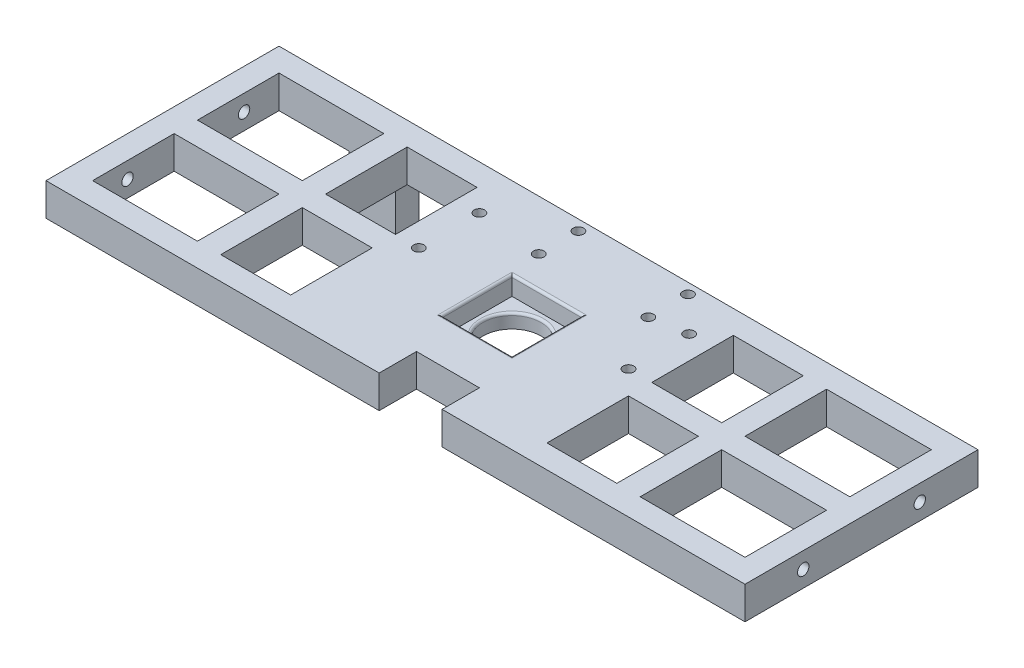
from build123d import *

# Parameters (mm, degrees)
SKETCH_1_W           = 300
SKETCH_1_H           = 100
EXTRUDE_1_DEPTH      = 16
SKETCH_2_W           = 30
SKETCH_2_H           = 30
CUT_EXTRUDE_1_DEPTH  = 8
SKETCH_3_R           = 12.5
CUT_EXTRUDE_2_DEPTH  = 14
CUT_EXTRUDE_3_REACH  = 318.632
SKETCH_4_W           = 50
SKETCH_4_H           = 35
SKETCH_7_W           = 35
SKETCH_7_H           = 16
EXTRUDE_2_DEPTH      = 20
SKETCH_8_W           = 35
SKETCH_8_H           = 16
EXTRUDE_3_DEPTH      = 20
SKETCH_9_W           = 20
SKETCH_9_H           = 10
EXTRUDE_4_DEPTH      = 25
FILLET_1_R           = 1
FILLET_2_R           = 1
SKETCH_13_W          = 35
SKETCH_13_H          = 16
EXTRUDE_6_DEPTH      = 4
SKETCH_14_W          = 35
SKETCH_14_H          = 16
EXTRUDE_7_DEPTH      = 4
SKETCH_17_W          = 35
SKETCH_17_H          = 16
EXTRUDE_8_DEPTH      = 1
SKETCH_18_W          = 35
SKETCH_18_H          = 16
EXTRUDE_9_DEPTH      = 1
CUT_EXTRUDE_15_DEPTH = 2
SKETCH_28_R          = 2.25
CUT_EXTRUDE_18_DEPTH = 5
SKETCH_30_R          = 1.5
CUT_EXTRUDE_20_DEPTH = 4
SKETCH_33_R          = 2.45
CUT_EXTRUDE_22_DEPTH = 13.2
CUT_EXTRUDE_START    = -13.2
SKETCH_34_R          = 2.45
CUT_EXTRUDE_23_DEPTH = 13.2
SKETCH_35_W          = 27
SKETCH_35_H          = 16
CUT_EXTRUDE_24_DEPTH = 20


with BuildPart() as part:
    # 草图1 → 凸台-拉伸1 (new body)
    with BuildSketch(Plane(origin=(0, 0, 0), x_dir=(1, 0, 0), z_dir=(0, 1, 0))):
        with Locations((-150, 50)):
            Rectangle(SKETCH_1_W, SKETCH_1_H)
    extrude(amount=EXTRUDE_1_DEPTH)

    # 草图2 → 切除-拉伸1 (cut)
    with BuildSketch(Plane(origin=(0, 16, 0), x_dir=(1, 0, 0), z_dir=(0, 1, 0))):
        with Locations((-150, 50)):
            Rectangle(SKETCH_2_W, SKETCH_2_H)
    extrude(amount=-CUT_EXTRUDE_1_DEPTH, mode=Mode.SUBTRACT)

    # 草图3 → 切除-拉伸2 (cut)
    with BuildSketch(Plane(origin=(0, 8, 0), x_dir=(1, 0, 0), z_dir=(0, 1, 0))):
        with Locations((-150, 50)):
            Circle(SKETCH_3_R)
    extrude(amount=-CUT_EXTRUDE_2_DEPTH, mode=Mode.SUBTRACT)

    # 草图4 → 切除-拉伸3 (cut, up to next)
    with BuildSketch(Plane(origin=(0, 16, 0), x_dir=(1, 0, 0), z_dir=(0, 1, 0)), mode=Mode.PRIVATE) as cut_extrude_3_sk1:
        with Locations((-270, 72.5)):
            Rectangle(SKETCH_4_W, SKETCH_4_H)
    cut_extrude_3_tool1 = extrude(cut_extrude_3_sk1.sketch, amount=-CUT_EXTRUDE_3_REACH, mode=Mode.PRIVATE) & part.part
    # 草图4 → 切除-拉伸3 (cut, up to next)
    with BuildSketch(Plane(origin=(0, 16, 0), x_dir=(1, 0, 0), z_dir=(0, 1, 0)), mode=Mode.PRIVATE) as cut_extrude_3_sk2:
        with Locations((-270, 27.5)):
            Rectangle(SKETCH_4_W, SKETCH_4_H)
    cut_extrude_3_tool2 = extrude(cut_extrude_3_sk2.sketch, amount=-CUT_EXTRUDE_3_REACH, mode=Mode.PRIVATE) & part.part
    # 草图4 → 切除-拉伸3 (cut, up to next)
    with BuildSketch(Plane(origin=(0, 16, 0), x_dir=(1, 0, 0), z_dir=(0, 1, 0)), mode=Mode.PRIVATE) as cut_extrude_3_sk3:
        with Locations((-210, 72.5)):
            Rectangle(SKETCH_4_W, SKETCH_4_H)
    cut_extrude_3_tool3 = extrude(cut_extrude_3_sk3.sketch, amount=-CUT_EXTRUDE_3_REACH, mode=Mode.PRIVATE) & part.part
    # 草图4 → 切除-拉伸3 (cut, up to next)
    with BuildSketch(Plane(origin=(0, 16, 0), x_dir=(1, 0, 0), z_dir=(0, 1, 0)), mode=Mode.PRIVATE) as cut_extrude_3_sk4:
        with Locations((-210, 27.5)):
            Rectangle(SKETCH_4_W, SKETCH_4_H)
    cut_extrude_3_tool4 = extrude(cut_extrude_3_sk4.sketch, amount=-CUT_EXTRUDE_3_REACH, mode=Mode.PRIVATE) & part.part
    # 草图4 → 切除-拉伸3 (cut, up to next)
    with BuildSketch(Plane(origin=(0, 16, 0), x_dir=(1, 0, 0), z_dir=(0, 1, 0)), mode=Mode.PRIVATE) as cut_extrude_3_sk5:
        with Locations((-30, 27.5)):
            Rectangle(SKETCH_4_W, SKETCH_4_H)
    cut_extrude_3_tool5 = extrude(cut_extrude_3_sk5.sketch, amount=-CUT_EXTRUDE_3_REACH, mode=Mode.PRIVATE) & part.part
    # 草图4 → 切除-拉伸3 (cut, up to next)
    with BuildSketch(Plane(origin=(0, 16, 0), x_dir=(1, 0, 0), z_dir=(0, 1, 0)), mode=Mode.PRIVATE) as cut_extrude_3_sk6:
        with Locations((-90, 27.5)):
            Rectangle(SKETCH_4_W, SKETCH_4_H)
    cut_extrude_3_tool6 = extrude(cut_extrude_3_sk6.sketch, amount=-CUT_EXTRUDE_3_REACH, mode=Mode.PRIVATE) & part.part
    # 草图4 → 切除-拉伸3 (cut, up to next)
    with BuildSketch(Plane(origin=(0, 16, 0), x_dir=(1, 0, 0), z_dir=(0, 1, 0)), mode=Mode.PRIVATE) as cut_extrude_3_sk7:
        with Locations((-90, 72.5)):
            Rectangle(SKETCH_4_W, SKETCH_4_H)
    cut_extrude_3_tool7 = extrude(cut_extrude_3_sk7.sketch, amount=-CUT_EXTRUDE_3_REACH, mode=Mode.PRIVATE) & part.part
    # 草图4 → 切除-拉伸3 (cut, up to next)
    with BuildSketch(Plane(origin=(0, 16, 0), x_dir=(1, 0, 0), z_dir=(0, 1, 0)), mode=Mode.PRIVATE) as cut_extrude_3_sk8:
        with Locations((-30, 72.5)):
            Rectangle(SKETCH_4_W, SKETCH_4_H)
    cut_extrude_3_tool8 = extrude(cut_extrude_3_sk8.sketch, amount=-CUT_EXTRUDE_3_REACH, mode=Mode.PRIVATE) & part.part
    add(cut_extrude_3_tool1.solids().sort_by_distance((-270, 16, -72.5))[0], mode=Mode.SUBTRACT)
    add(cut_extrude_3_tool2.solids().sort_by_distance((-270, 16, -27.5))[0], mode=Mode.SUBTRACT)
    add(cut_extrude_3_tool3.solids().sort_by_distance((-210, 16, -72.5))[0], mode=Mode.SUBTRACT)
    add(cut_extrude_3_tool4.solids().sort_by_distance((-210, 16, -27.5))[0], mode=Mode.SUBTRACT)
    add(cut_extrude_3_tool5.solids().sort_by_distance((-30, 16, -27.5))[0], mode=Mode.SUBTRACT)
    add(cut_extrude_3_tool6.solids().sort_by_distance((-90, 16, -27.5))[0], mode=Mode.SUBTRACT)
    add(cut_extrude_3_tool7.solids().sort_by_distance((-90, 16, -72.5))[0], mode=Mode.SUBTRACT)
    add(cut_extrude_3_tool8.solids().sort_by_distance((-30, 16, -72.5))[0], mode=Mode.SUBTRACT)

    # 草图7 → 凸台-拉伸2 (add)
    with BuildSketch(Plane.ZY.offset(185)):
        with Locations((-27.5, 8)):
            Rectangle(SKETCH_7_W, SKETCH_7_H)
        with Locations((-72.5, 8)):
            Rectangle(SKETCH_7_W, SKETCH_7_H)
    extrude(amount=EXTRUDE_2_DEPTH)

    # 草图8 → 凸台-拉伸3 (add)
    with BuildSketch(Plane(origin=(-115, 0, 0), x_dir=(0, 0, -1), z_dir=(1, 0, 0))):
        with Locations((27.5, 8)):
            Rectangle(SKETCH_8_W, SKETCH_8_H)
        with Locations((72.5, 8)):
            Rectangle(SKETCH_8_W, SKETCH_8_H)
    extrude(amount=EXTRUDE_3_DEPTH)

    # 草图9 → 凸台-拉伸4 (add)
    with BuildSketch(Plane.XZ):
        with Locations((-250, -95)):
            Rectangle(SKETCH_9_W, SKETCH_9_H)
    extrude(amount=EXTRUDE_4_DEPTH)

    # 圆角1
    fillet_1_edges = [part.edges().sort_by_distance(p)[0] for p in [
        (-162.5, 8, -50),
    ]]
    fillet(fillet_1_edges, radius=FILLET_1_R)

    # 圆角2
    fillet_2_edges = [part.edges().sort_by_distance(p)[0] for p in [
        (-135, 16, -50),
        (-150, 16, -65),
        (-150, 16, -35),
        (-165, 16, -50),
    ]]
    fillet(fillet_2_edges, radius=FILLET_2_R)

    # 草图13 → 凸台-拉伸6 (add)
    with BuildSketch(Plane.ZY.offset(5)):
        with Locations((-72.5, 8)):
            Rectangle(SKETCH_13_W, SKETCH_13_H)
        with Locations((-27.5, 8)):
            Rectangle(SKETCH_13_W, SKETCH_13_H)
    extrude(amount=EXTRUDE_6_DEPTH)

    # 草图14 → 凸台-拉伸7 (add)
    with BuildSketch(Plane(origin=(-295, 0, 0), x_dir=(0, 0, -1), z_dir=(1, 0, 0))):
        with Locations((72.5, 8)):
            Rectangle(SKETCH_14_W, SKETCH_14_H)
        with Locations((27.5, 8)):
            Rectangle(SKETCH_14_W, SKETCH_14_H)
    extrude(amount=EXTRUDE_7_DEPTH)

    # 草图17 → 凸台-拉伸8 (add)
    with BuildSketch(Plane(origin=(-291, 0, 0), x_dir=(0, 0, -1), z_dir=(1, 0, 0))):
        with Locations((27.5, 8)):
            Rectangle(SKETCH_17_W, SKETCH_17_H)
        with Locations((72.5, 8)):
            Rectangle(SKETCH_17_W, SKETCH_17_H)
    extrude(amount=EXTRUDE_8_DEPTH)

    # 草图18 → 凸台-拉伸9 (add)
    with BuildSketch(Plane.ZY.offset(9)):
        with Locations((-27.5, 8)):
            Rectangle(SKETCH_18_W, SKETCH_18_H)
        with Locations((-72.5, 8)):
            Rectangle(SKETCH_18_W, SKETCH_18_H)
    extrude(amount=EXTRUDE_9_DEPTH)

    # 草图26 → 切除-拉伸15 (cut)
    with BuildSketch(Plane.XZ):
        Polygon((-260, -90), (-290, -90), (-290, -55), (-245, -55), (-245, -90), (-240, -90), (-240, -100), (0, -100), (0, 0), (-300, 0), (-300, -100), (-260, -100), align=None)
    extrude(amount=-CUT_EXTRUDE_15_DEPTH, mode=Mode.SUBTRACT)

    # 草图28 → 切除-拉伸18 (cut)
    with BuildSketch(Plane(origin=(0, 16, 0), x_dir=(1, 0, 0), z_dir=(0, 1, 0))):
        with Locations((-105.002761288, 55.000000147)):
            Circle(SKETCH_28_R)
        with Locations((-105, 81)):
            Circle(SKETCH_28_R)
        with Locations((-120, 78.499971194)):
            Circle(SKETCH_28_R)
        with Locations((-120, 95.5)):
            Circle(SKETCH_28_R)
        with Locations((-167.000079641, 78.5)):
            Circle(SKETCH_28_R)
        with Locations((-167.000079641, 95.5)):
            Circle(SKETCH_28_R)
        with Locations((-195, 54.99995086)):
            Circle(SKETCH_28_R)
        with Locations((-195, 81)):
            Circle(SKETCH_28_R)
    extrude(amount=-CUT_EXTRUDE_18_DEPTH, mode=Mode.SUBTRACT)

    # 草图30 → 切除-拉伸20 (cut)
    with BuildSketch(Plane(origin=(0, 11, 0), x_dir=(1, 0, 0), z_dir=(0, 1, 0))):
        with Locations((-195, 81)):
            Circle(SKETCH_30_R)
        with Locations((-195, 54.99995086)):
            Circle(SKETCH_30_R)
        with Locations((-167.000079641, 95.5)):
            Circle(SKETCH_30_R)
        with Locations((-167.000079641, 78.5)):
            Circle(SKETCH_30_R)
        with Locations((-120, 95.5)):
            Circle(SKETCH_30_R)
        with Locations((-120, 78.499971194)):
            Circle(SKETCH_30_R)
        with Locations((-105, 81)):
            Circle(SKETCH_30_R)
        with Locations((-105.002761288, 55.000000147)):
            Circle(SKETCH_30_R)
    extrude(amount=-CUT_EXTRUDE_20_DEPTH, mode=Mode.SUBTRACT)

    # 草图33 → 切除-拉伸22 (cut)
    with BuildSketch(Plane.ZY.offset(300)):
        with Locations((-75, 9)):
            Circle(SKETCH_33_R)
        with Locations((-25, 9)):
            Circle(SKETCH_33_R)
    extrude(amount=-CUT_EXTRUDE_22_DEPTH, mode=Mode.SUBTRACT)

    # 草图34 → 切除-拉伸23 (cut)
    with BuildSketch(Plane(origin=(0, 0, 0), x_dir=(0, 0, -1), z_dir=(1, 0, 0)).offset(CUT_EXTRUDE_START)):
        with Locations((75, 9)):
            Circle(SKETCH_34_R)
        with Locations((25, 9)):
            Circle(SKETCH_34_R)
    extrude(amount=CUT_EXTRUDE_23_DEPTH, mode=Mode.SUBTRACT)

    # 草图35 → 切除-拉伸24 (cut)
    with BuildSketch(Plane(origin=(0, 16, 0), x_dir=(1, 0, 0), z_dir=(0, 1, 0))):
        with Locations((-143.5, 8)):
            Rectangle(SKETCH_35_W, SKETCH_35_H)
    extrude(amount=-CUT_EXTRUDE_24_DEPTH, mode=Mode.SUBTRACT)


solid = part.part
